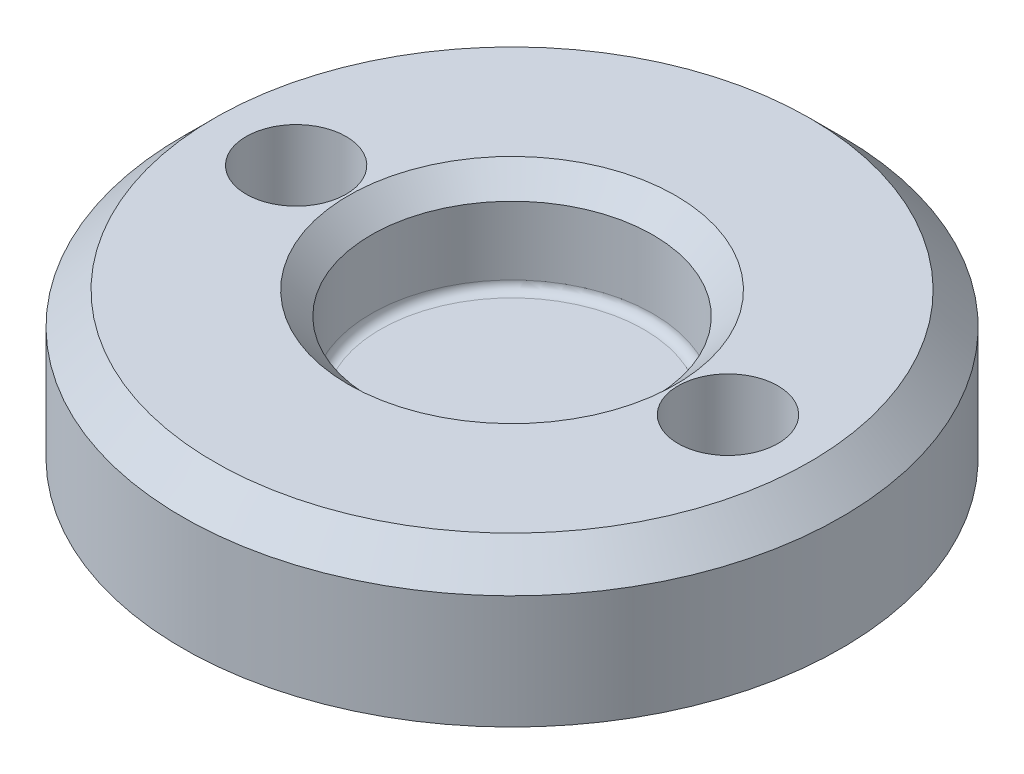
from build123d import *

# Parameters (mm, degrees)
CHAMFER2_SIZE     = 0.5
CIRPATTERN1_COUNT = 2
CHAMFER3_SIZE     = 0.7
FILLET2_R         = 0.2


with BuildPart() as part:
    # Sketch1 → Revolve1 (revolve)
    with BuildSketch(Plane.XY):
        Polygon((0, 0), (-7.25, 0), (-7.25, 3.2), (-3.1, 3.2), (-3.1, 1), (0, 1), align=None)
    revolve(axis=Axis((0, 0, 0), (0, 1, 0)))

    # Chamfer2
    chamfer2_edges = [part.edges().sort_by_distance(p)[0] for p in [
        (3.1, 3.2, 0),
    ]]
    chamfer(chamfer2_edges, length=CHAMFER2_SIZE)

    # Sketch4 → CSK for M2 Flat Head Machine Screw1 (revolve, cut)
    with BuildSketch(Plane(origin=(-4.75, 0, 0), x_dir=(0, 0, -1), z_dir=(1, 0, 0))):
        Polygon((0, 0), (0, 5.660946681), (1.1, 5), (1.1, 1.1), (2.2, 0), align=None)
    csk_for_m2_flat_head_machine_screw1 = revolve(axis=Axis((-4.75, -6.35, 0), (0, 1, 0)), mode=Mode.SUBTRACT)

    # CirPattern1: CSK for M2 Flat Head Machine Screw1 ×2 about axis
    cirpattern1_axis = Axis((0, 0, 0), (0, -1, 0))
    for i in range(1, CIRPATTERN1_COUNT):
        add(csk_for_m2_flat_head_machine_screw1.rotate(cirpattern1_axis, i * 360 / CIRPATTERN1_COUNT), mode=Mode.SUBTRACT)

    # Chamfer3
    chamfer3_edges = [part.edges().sort_by_distance(p)[0] for p in [
        (7.25, 3.2, 0),
    ]]
    chamfer(chamfer3_edges, length=CHAMFER3_SIZE)

    # Fillet2
    fillet2_edges = [part.edges().sort_by_distance(p)[0] for p in [
        (3.1, 1, 0),
    ]]
    fillet(fillet2_edges, radius=FILLET2_R)


solid = part.part
